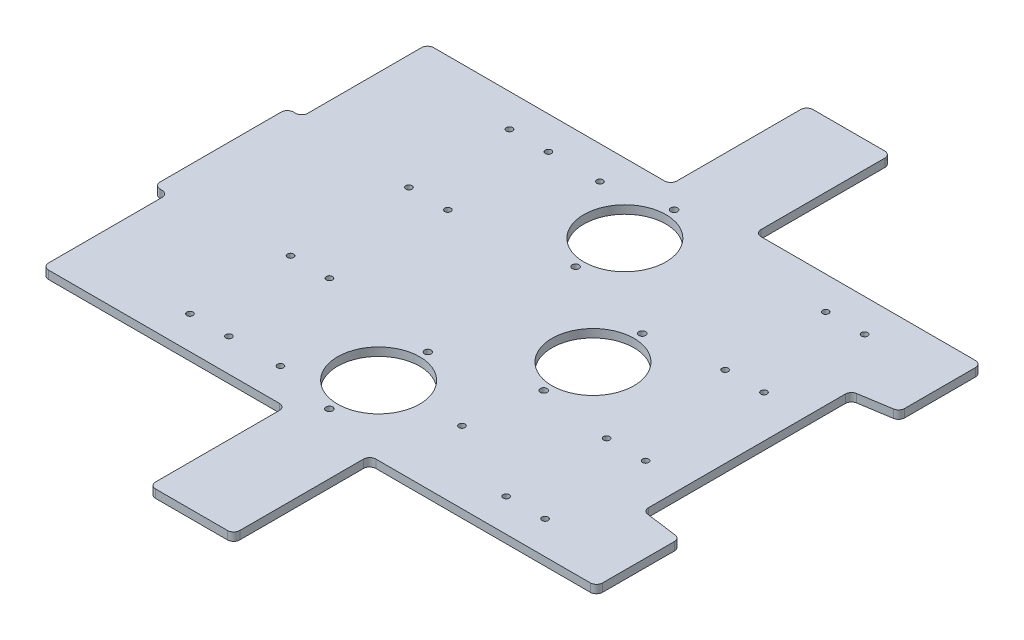
from build123d import *

# Parameters (mm, degrees)
SKETCH1_R           = 20
SKETCH1_R_2         = 1.5
SKETCH1_R_3         = 1.65
BOSS_EXTRUDE2_DEPTH = 4
FILLET1_R           = 3


with BuildPart() as part:
    # Sketch1 → Boss-Extrude2 (new body)
    with BuildSketch(Plane(origin=(0, 0, 0), x_dir=(1, 0, 0), z_dir=(0, 1, 0))):
        Polygon((92.45867298, 93.85), (92.45867298, 53.803836873), (71.914755495, 50.55), (71.914755495, -50.55), (92.528223413, -53.3293777), (92.45867298, -93.85), (-18.04132702, -93.85), (-18.04132702, -160.15), (-59.04132702, -160.15), (-59.04132702, -93.85), (-177.54132702, -93.85), (-177.54132702, -32.5), (-184.54132702, -32.5), (-184.54132702, 32.5), (-177.54132702, 32.5), (-177.54132702, 34.274594508), (-177.54132702, 93.85), (-59.04132702, 93.85), (-59.04132702, 160.15), (-18.04132702, 160.15), (-18.04132702, 93.85), align=None)
        with Locations((-47.54132702, 60)):
            Circle(SKETCH1_R, mode=Mode.SUBTRACT)
        with Locations((-3.085244505, 0)):
            Circle(SKETCH1_R, mode=Mode.SUBTRACT)
        with Locations((-47.54132702, -60)):
            Circle(SKETCH1_R, mode=Mode.SUBTRACT)
        with Locations((-77.54132702, 77.85)):
            Circle(SKETCH1_R_2, mode=Mode.SUBTRACT)
        with Locations((-121.62132702, 28.85)):
            Circle(SKETCH1_R_2, mode=Mode.SUBTRACT)
        with Locations((-102.65132702, 28.85)):
            Circle(SKETCH1_R_2, mode=Mode.SUBTRACT)
        with Locations((-121.62132702, -28.85)):
            Circle(SKETCH1_R_2, mode=Mode.SUBTRACT)
        with Locations((-102.65132702, -28.85)):
            Circle(SKETCH1_R_2, mode=Mode.SUBTRACT)
        with Locations((-77.54132702, -77.85)):
            Circle(SKETCH1_R_2, mode=Mode.SUBTRACT)
        with Locations((32.45867298, 77.85)):
            Circle(SKETCH1_R_2, mode=Mode.SUBTRACT)
        with Locations((-8.085244505, -58.85)):
            Circle(SKETCH1_R_2, mode=Mode.SUBTRACT)
        with Locations((32.45867298, -77.85)):
            Circle(SKETCH1_R_2, mode=Mode.SUBTRACT)
        with Locations((-121.62132702, -77.85)):
            Circle(SKETCH1_R_2, mode=Mode.SUBTRACT)
        with Locations((-102.65132702, -77.85)):
            Circle(SKETCH1_R_2, mode=Mode.SUBTRACT)
        with Locations((51.42867298, -77.85)):
            Circle(SKETCH1_R_2, mode=Mode.SUBTRACT)
        with Locations((32.444755495, -28.85)):
            Circle(SKETCH1_R_2, mode=Mode.SUBTRACT)
        with Locations((51.414755495, -28.85)):
            Circle(SKETCH1_R_2, mode=Mode.SUBTRACT)
        with Locations((-121.62132702, 77.85)):
            Circle(SKETCH1_R_2, mode=Mode.SUBTRACT)
        with Locations((-102.65132702, 77.85)):
            Circle(SKETCH1_R_2, mode=Mode.SUBTRACT)
        with Locations((51.414755495, 28.85)):
            Circle(SKETCH1_R_2, mode=Mode.SUBTRACT)
        with Locations((32.444755495, 28.85)):
            Circle(SKETCH1_R_2, mode=Mode.SUBTRACT)
        with Locations((51.42867298, 77.85)):
            Circle(SKETCH1_R_2, mode=Mode.SUBTRACT)
        with Locations((-47.54132702, -84)):
            Circle(SKETCH1_R_3, mode=Mode.SUBTRACT)
        with Locations((-47.54132702, -36)):
            Circle(SKETCH1_R_3, mode=Mode.SUBTRACT)
        with Locations((-3.085244505, -24)):
            Circle(SKETCH1_R_3, mode=Mode.SUBTRACT)
        with Locations((-3.085244505, 24)):
            Circle(SKETCH1_R_3, mode=Mode.SUBTRACT)
        with Locations((-47.54132702, 36)):
            Circle(SKETCH1_R_3, mode=Mode.SUBTRACT)
        with Locations((-47.54132702, 84)):
            Circle(SKETCH1_R_3, mode=Mode.SUBTRACT)
    extrude(amount=BOSS_EXTRUDE2_DEPTH)

    # Fillet1
    fillet1_edges = [part.edges().sort_by_distance(p)[0] for p in [
        (-177.54132702, 2, -93.85),
        (-184.54132702, 2, -32.5),
        (-177.54132702, 2, -32.5),
        (-184.54132702, 2, 32.5),
        (-177.54132702, 2, 32.5),
        (-177.54132702, 2, 93.85),
        (-59.04132702, 2, 93.85),
        (-59.04132702, 2, 160.15),
        (-18.04132702, 2, 160.15),
        (-18.04132702, 2, 93.85),
        (92.45867298, 2, 93.85),
        (92.528223413, 2, 53.3293777),
        (71.914755495, 2, 50.55),
        (71.914755495, 2, -50.55),
        (92.45867298, 2, -53.803836873),
        (92.45867298, 2, -93.85),
        (-59.04132702, 2, -93.85),
        (-18.04132702, 2, -93.85),
        (-18.04132702, 2, -160.15),
        (-59.04132702, 2, -160.15),
    ]]
    fillet(fillet1_edges, radius=FILLET1_R)


solid = part.part
